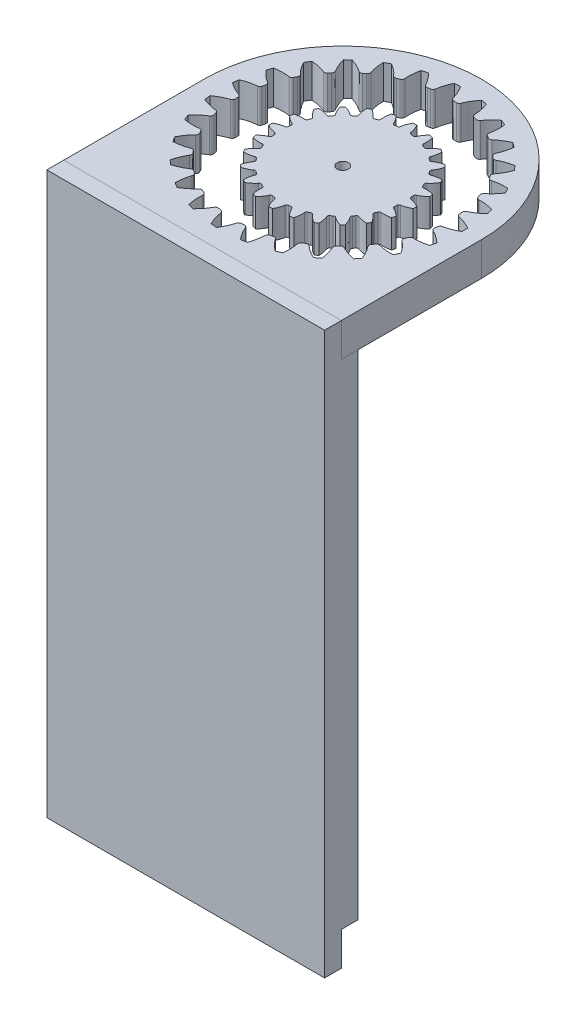
from build123d import *

# Parameters (mm, degrees)
SALIENTE_EXTRUIR1_OUTLINE_R         = 18.9375
SALIENTE_EXTRUIR1_DEPTH             = 6
SALIENTE_EXTRUIR1_2_OUTLINE_R       = 1
SALIENTE_EXTRUIR1_2_DEPTH           = 5
CORTAR_EXTRUIR2_DEPTH               = 36.68700744
REDONDEO1_R                         = 0.518506287
MATRIZC1_COUNT                      = 27
REDONDEO1_OF_MATRIZC1_R             = 0.518506287
SALIENTE_EXTRUIR2_REACH             = 37.687
SALIENTE_EXTRUIR2_DIRECTION_2_REACH = 37.687


with BuildPart() as part:
    # Saliente-Extruir1: read off the stored shape, not the designer's step
    # Saliente-Extruir1 outline → Saliente-Extruir1 (new body)
    with BuildSketch(Plane(origin=(0, 0, 0), x_dir=(1, 0, 0), z_dir=(0, 1, 0))):
        with BuildLine():
            ThreePointArc((24.75, 0), (0, 24.75), (-24.75, 0))
            Line((-24.75, 0), (-24.75, -25))
            Line((-24.75, -25), (24.75, -25))
            Line((24.75, -25), (24.75, 0))
        make_face()
        Circle(SALIENTE_EXTRUIR1_OUTLINE_R, mode=Mode.SUBTRACT)
    extrude(amount=SALIENTE_EXTRUIR1_DEPTH)

    # Croquis6 → Cortar-Extruir2 (cut, through all)
    with BuildSketch(Plane(origin=(0, 0, 0), x_dir=(1, 0, 0), z_dir=(0, 1, 0))):
        with BuildLine():
            Line((18.645829575, 1.539234613), (0, 0))
            Line((0, 0), (18.645829575, -1.539234613))
            add(Edge.make_bspline(
                [(18.645829575, -1.539234613), (18.923303573, -1.557894661), (19.482127586, -1.453363756), (20.528479497, -1.153187297), (21.271841826, -0.800092087), (21.743398201, -0.535849476)],
                knots=[0, 0, 0, 0, 0.227272729, 0.454545457, 0.900910646, 0.900910646, 0.900910646, 0.900910646], degree=3))
            ThreePointArc((21.743398201, -0.535849476), (21.75, 0), (21.743398201, 0.535849476))
            add(Edge.make_bspline(
                [(18.645829575, 1.539234613), (18.923303573, 1.557894661), (19.482127586, 1.453363756), (20.528479497, 1.153187297), (21.271841826, 0.800092087), (21.743398201, 0.535849476)],
                knots=[0, 0, 0, 0, 0.227272729, 0.454545457, 0.900910646, 0.900910646, 0.900910646, 0.900910646], degree=3))
        make_face()
    cortar_extruir2 = extrude(amount=CORTAR_EXTRUIR2_DEPTH, mode=Mode.SUBTRACT)

    # Redondeo1
    redondeo1_edges = [part.edges().sort_by_distance(p)[0] for p in [
        (18.87479761, 3, 1.539779672),
        (18.87479761, 3, -1.539779672),
    ]]
    fillet(redondeo1_edges, radius=REDONDEO1_R)

    # MatrizC1: Cortar-Extruir2 ×27 about axis
    matrizc1_axis = Axis((0, 6, 0), (0, -1, 0))
    for i in range(1, MATRIZC1_COUNT):
        add(cortar_extruir2.rotate(matrizc1_axis, i * 360 / MATRIZC1_COUNT), mode=Mode.SUBTRACT)

    # Redondeo1 of MatrizC1
    redondeo1_of_matrizc1_edges = [part.edges().sort_by_distance(p)[0] for p in [
        (18.010927368, 3, 5.851102598),
        (18.721122627, 3, 2.854553174),
        (16.176083369, 3, 9.846991068),
        (17.558187078, 3, 7.09499632),
        (13.469182529, 3, 13.312025701),
        (15.448685119, 3, 10.952946377),
        (10.036154572, 3, 16.059405582),
        (12.506340546, 3, 14.220420261),
        (6.062074925, 3, 17.941018752),
        (8.889775917, 3, 16.721267607),
        (1.76118725, 3, 18.855426957),
        (4.793961168, 3, 18.320667089),
        (-2.634646487, 3, 18.753334214),
        (0.439702731, 3, 18.932394665),
        (-6.888445749, 3, 17.64024437),
        (-3.938260194, 3, 18.523471945),
        (-10.770887117, 3, 15.576164385),
        (-8.103910492, 3, 17.115944058),
        (-14.072667174, 3, 12.672369347),
        (-11.832676879, 3, 14.785691196),
        (-16.6157861, 3, 9.085403597),
        (-14.923540592, 3, 11.658337894),
        (-18.263143697, 3, 5.008641388),
        (-17.209872369, 3, 7.902480579),
        (-18.92593049, 3, 0.661862025),
        (-18.568415471, 3, 3.720598491),
        (-18.568415471, 3, -3.720598491),
        (-18.92593049, 3, -0.661862025),
        (-17.209872369, 3, -7.902480579),
        (-18.263143697, 3, -5.008641388),
        (-14.923540592, 3, -11.658337894),
        (-16.6157861, 3, -9.085403597),
        (-11.832676879, 3, -14.785691196),
        (-14.072667174, 3, -12.672369347),
        (-8.103910492, 3, -17.115944058),
        (-10.770887117, 3, -15.576164385),
        (-3.938260194, 3, -18.523471945),
        (-6.888445749, 3, -17.64024437),
        (0.439702731, 3, -18.932394665),
        (-2.634646487, 3, -18.753334214),
        (4.793961168, 3, -18.320667089),
        (1.76118725, 3, -18.855426957),
        (8.889775917, 3, -16.721267607),
        (6.062074925, 3, -17.941018752),
        (12.506340546, 3, -14.220420261),
        (10.036154572, 3, -16.059405582),
        (15.448685119, 3, -10.952946377),
        (13.469182529, 3, -13.312025701),
        (17.558187078, 3, -7.09499632),
        (16.176083369, 3, -9.846991068),
        (18.721122627, 3, -2.854553174),
        (18.010927368, 3, -5.851102598),
    ]]
    fillet(redondeo1_of_matrizc1_edges, radius=REDONDEO1_OF_MATRIZC1_R)


with BuildPart() as body_2:
    # Saliente-Extruir1 2 outline → Saliente-Extruir1 2 (new body)
    with BuildSketch(Plane(origin=(0, 0, 0), x_dir=(1, 0, 0), z_dir=(0, 1, 0))):
        with BuildLine():
            ThreePointArc((10.245544348, 4.003601007), (10.162674858, 4.209517756), (10.075667306, 4.413720464))
            ThreePointArc((10.075667306, 4.413720464), (10.058954126, 4.643932984), (10.190868437, 4.833341931))
            add(Edge.make_bspline(
                [(10.190868437, 4.833341931), (10.274511974, 4.893314904), (10.478844857, 5.076658208), (10.881439467, 5.495896135), (11.153594645, 5.8906927), (11.309814146, 6.152538418)],
                knots=[0.087836958, 0.087836958, 0.087836958, 0.087836958, 0.227272729, 0.454545457, 0.858139361, 0.858139361, 0.858139361, 0.858139361], degree=3))
            ThreePointArc((11.309814146, 6.152538418), (11.150077074, 6.4375), (10.983161641, 6.718317153))
            add(Edge.make_bspline(
                [(10.983161641, 6.718317153), (10.678286846, 6.713949957), (10.200305403, 6.67565494), (9.635937403, 6.536616745), (9.374991003, 6.451330929), (9.281231116, 6.408879988)],
                knots=[0.050951553, 0.050951553, 0.050951553, 0.050951553, 0.454545457, 0.681818186, 0.821253956, 0.821253956, 0.821253956, 0.821253956], degree=3))
            ThreePointArc((9.281231116, 6.408879988), (9.051241001, 6.389343317), (8.8602277, 6.518923615))
            ThreePointArc((8.8602277, 6.518923615), (8.726886743, 6.696375719), (8.589992352, 6.871101177))
            ThreePointArc((8.589992352, 6.871101177), (8.514265275, 7.089143706), (8.592662073, 7.306240636))
            add(Edge.make_bspline(
                [(8.592662073, 7.306240636), (8.657933378, 7.38581862), (8.807851047, 7.615799894), (9.088220819, 8.124951788), (9.248921664, 8.576734929), (9.332047455, 8.870091053)],
                knots=[0.087836958, 0.087836958, 0.087836958, 0.087836958, 0.227272729, 0.454545457, 0.858139361, 0.858139361, 0.858139361, 0.858139361], degree=3))
            ThreePointArc((9.332047455, 8.870091053), (9.103999808, 9.103999808), (8.870091053, 9.332047455))
            add(Edge.make_bspline(
                [(8.870091053, 9.332047455), (8.576734929, 9.248921664), (8.124951788, 9.088220819), (7.615799894, 8.807851047), (7.38581862, 8.657933378), (7.306240636, 8.592662073)],
                knots=[0.050951553, 0.050951553, 0.050951553, 0.050951553, 0.454545457, 0.681818186, 0.821253956, 0.821253956, 0.821253956, 0.821253956], degree=3))
            ThreePointArc((7.306240636, 8.592662073), (7.089143706, 8.514265275), (6.871101177, 8.589992352))
            ThreePointArc((6.871101177, 8.589992352), (6.696375719, 8.726886743), (6.518923615, 8.8602277))
            ThreePointArc((6.518923615, 8.8602277), (6.389343317, 9.051241001), (6.408879988, 9.281231116))
            add(Edge.make_bspline(
                [(6.408879988, 9.281231116), (6.451330929, 9.374991003), (6.536616745, 9.635937403), (6.67565494, 10.200305403), (6.713949957, 10.678286846), (6.718317153, 10.983161641)],
                knots=[0.087836958, 0.087836958, 0.087836958, 0.087836958, 0.227272729, 0.454545457, 0.858139361, 0.858139361, 0.858139361, 0.858139361], degree=3))
            ThreePointArc((6.718317153, 10.983161641), (6.4375, 11.150077074), (6.152538418, 11.309814146))
            add(Edge.make_bspline(
                [(6.152538418, 11.309814146), (5.8906927, 11.153594645), (5.495896135, 10.881439467), (5.076658208, 10.478844857), (4.893314904, 10.274511974), (4.833341931, 10.190868437)],
                knots=[0.050951553, 0.050951553, 0.050951553, 0.050951553, 0.454545457, 0.681818186, 0.821253956, 0.821253956, 0.821253956, 0.821253956], degree=3))
            ThreePointArc((4.833341931, 10.190868437), (4.643932984, 10.058954126), (4.413720464, 10.075667306))
            ThreePointArc((4.413720464, 10.075667306), (4.209517756, 10.162674858), (4.003601007, 10.245544348))
            ThreePointArc((4.003601007, 10.245544348), (3.82899817, 10.396511178), (3.788343323, 10.623721033))
            add(Edge.make_bspline(
                [(3.788343323, 10.623721033), (3.805080939, 10.725273242), (3.819922813, 10.999401702), (3.80815421, 11.580525062), (3.721433655, 12.052131162), (3.646744639, 12.347747914)],
                knots=[0.087836958, 0.087836958, 0.087836958, 0.087836958, 0.227272729, 0.454545457, 0.858139361, 0.858139361, 0.858139361, 0.858139361], degree=3))
            ThreePointArc((3.646744639, 12.347747914), (3.332295205, 12.436295013), (3.015700458, 12.516835692))
            add(Edge.make_bspline(
                [(3.015700458, 12.516835692), (2.803209498, 12.298168583), (2.492304244, 11.933105998), (2.191550655, 11.435722707), (2.067339864, 11.190899559), (2.03105896, 11.094583959)],
                knots=[0.050951553, 0.050951553, 0.050951553, 0.050951553, 0.454545457, 0.681818186, 0.821253956, 0.821253956, 0.821253956, 0.821253956], degree=3))
            ThreePointArc((2.03105896, 11.094583959), (1.882245903, 10.918141876), (1.655551995, 10.874702184))
            ThreePointArc((1.655551995, 10.874702184), (1.435788114, 10.905893475), (1.215439606, 10.932644079))
            ThreePointArc((1.215439606, 10.932644079), (1.007713125, 11.033276301), (0.909637322, 11.242221919))
            add(Edge.make_bspline(
                [(0.909637322, 11.242221919), (0.899520971, 11.344645833), (0.842907454, 11.613274952), (0.681134064, 12.171551076), (0.475307799, 12.604642656), (0.326652505, 12.870855571)],
                knots=[0.087836958, 0.087836958, 0.087836958, 0.087836958, 0.227272729, 0.454545457, 0.858139361, 0.858139361, 0.858139361, 0.858139361], degree=3))
            ThreePointArc((0.326652505, 12.870855571), (0, 12.875), (-0.326652505, 12.870855571))
            add(Edge.make_bspline(
                [(-0.326652505, 12.870855571), (-0.475307799, 12.604642656), (-0.681134064, 12.171551076), (-0.842907454, 11.613274952), (-0.899520971, 11.344645833), (-0.909637322, 11.242221919)],
                knots=[0.050951553, 0.050951553, 0.050951553, 0.050951553, 0.454545457, 0.681818186, 0.821253956, 0.821253956, 0.821253956, 0.821253956], degree=3))
            ThreePointArc((-0.909637322, 11.242221919), (-1.007713125, 11.033276301), (-1.215439606, 10.932644079))
            ThreePointArc((-1.215439606, 10.932644079), (-1.435788114, 10.905893475), (-1.655551995, 10.874702184))
            ThreePointArc((-1.655551995, 10.874702184), (-1.882245903, 10.918141876), (-2.03105896, 11.094583959))
            add(Edge.make_bspline(
                [(-2.03105896, 11.094583959), (-2.067339864, 11.190899559), (-2.191550655, 11.435722707), (-2.492304244, 11.933105998), (-2.803209498, 12.298168583), (-3.015700458, 12.516835692)],
                knots=[0.087836958, 0.087836958, 0.087836958, 0.087836958, 0.227272729, 0.454545457, 0.858139361, 0.858139361, 0.858139361, 0.858139361], degree=3))
            ThreePointArc((-3.015700458, 12.516835692), (-3.332295205, 12.436295013), (-3.646744639, 12.347747914))
            add(Edge.make_bspline(
                [(-3.646744639, 12.347747914), (-3.721433655, 12.052131162), (-3.80815421, 11.580525062), (-3.819922813, 10.999401702), (-3.805080939, 10.725273242), (-3.788343323, 10.623721033)],
                knots=[0.050951553, 0.050951553, 0.050951553, 0.050951553, 0.454545457, 0.681818186, 0.821253956, 0.821253956, 0.821253956, 0.821253956], degree=3))
            ThreePointArc((-3.788343323, 10.623721033), (-3.82899817, 10.396511178), (-4.003601007, 10.245544348))
            ThreePointArc((-4.003601007, 10.245544348), (-4.209517756, 10.162674858), (-4.413720464, 10.075667306))
            ThreePointArc((-4.413720464, 10.075667306), (-4.643932984, 10.058954126), (-4.833341931, 10.190868437))
            add(Edge.make_bspline(
                [(-4.833341931, 10.190868437), (-4.893314904, 10.274511974), (-5.076658208, 10.478844857), (-5.495896135, 10.881439467), (-5.8906927, 11.153594645), (-6.152538418, 11.309814146)],
                knots=[0.087836958, 0.087836958, 0.087836958, 0.087836958, 0.227272729, 0.454545457, 0.858139361, 0.858139361, 0.858139361, 0.858139361], degree=3))
            ThreePointArc((-6.152538418, 11.309814146), (-6.4375, 11.150077074), (-6.718317153, 10.983161641))
            add(Edge.make_bspline(
                [(-6.718317153, 10.983161641), (-6.713949957, 10.678286846), (-6.67565494, 10.200305403), (-6.536616745, 9.635937403), (-6.451330929, 9.374991003), (-6.408879988, 9.281231116)],
                knots=[0.050951553, 0.050951553, 0.050951553, 0.050951553, 0.454545457, 0.681818186, 0.821253956, 0.821253956, 0.821253956, 0.821253956], degree=3))
            ThreePointArc((-6.408879988, 9.281231116), (-6.389343317, 9.051241001), (-6.518923615, 8.8602277))
            ThreePointArc((-6.518923615, 8.8602277), (-6.696375719, 8.726886743), (-6.871101177, 8.589992352))
            ThreePointArc((-6.871101177, 8.589992352), (-7.089143706, 8.514265275), (-7.306240636, 8.592662073))
            add(Edge.make_bspline(
                [(-7.306240636, 8.592662073), (-7.38581862, 8.657933378), (-7.615799894, 8.807851047), (-8.124951788, 9.088220819), (-8.576734929, 9.248921664), (-8.870091053, 9.332047455)],
                knots=[0.087836958, 0.087836958, 0.087836958, 0.087836958, 0.227272729, 0.454545457, 0.858139361, 0.858139361, 0.858139361, 0.858139361], degree=3))
            ThreePointArc((-8.870091053, 9.332047455), (-9.103999808, 9.103999808), (-9.332047455, 8.870091053))
            add(Edge.make_bspline(
                [(-9.332047455, 8.870091053), (-9.248921664, 8.576734929), (-9.088220819, 8.124951788), (-8.807851047, 7.615799894), (-8.657933378, 7.38581862), (-8.592662073, 7.306240636)],
                knots=[0.050951553, 0.050951553, 0.050951553, 0.050951553, 0.454545457, 0.681818186, 0.821253956, 0.821253956, 0.821253956, 0.821253956], degree=3))
            ThreePointArc((-8.592662073, 7.306240636), (-8.514265275, 7.089143706), (-8.589992352, 6.871101177))
            ThreePointArc((-8.589992352, 6.871101177), (-8.726886743, 6.696375719), (-8.8602277, 6.518923615))
            ThreePointArc((-8.8602277, 6.518923615), (-9.051241001, 6.389343317), (-9.281231116, 6.408879988))
            add(Edge.make_bspline(
                [(-9.281231116, 6.408879988), (-9.374991003, 6.451330929), (-9.635937403, 6.536616745), (-10.200305403, 6.67565494), (-10.678286846, 6.713949957), (-10.983161641, 6.718317153)],
                knots=[0.087836958, 0.087836958, 0.087836958, 0.087836958, 0.227272729, 0.454545457, 0.858139361, 0.858139361, 0.858139361, 0.858139361], degree=3))
            ThreePointArc((-10.983161641, 6.718317153), (-11.150077074, 6.4375), (-11.309814146, 6.152538418))
            add(Edge.make_bspline(
                [(-11.309814146, 6.152538418), (-11.153594645, 5.8906927), (-10.881439467, 5.495896135), (-10.478844857, 5.076658208), (-10.274511974, 4.893314904), (-10.190868437, 4.833341931)],
                knots=[0.050951553, 0.050951553, 0.050951553, 0.050951553, 0.454545457, 0.681818186, 0.821253956, 0.821253956, 0.821253956, 0.821253956], degree=3))
            ThreePointArc((-10.190868437, 4.833341931), (-10.058954126, 4.643932984), (-10.075667306, 4.413720464))
            ThreePointArc((-10.075667306, 4.413720464), (-10.162674858, 4.209517756), (-10.245544348, 4.003601007))
            ThreePointArc((-10.245544348, 4.003601007), (-10.396511178, 3.82899817), (-10.623721033, 3.788343323))
            add(Edge.make_bspline(
                [(-10.623721033, 3.788343323), (-10.725273242, 3.805080939), (-10.999401702, 3.819922813), (-11.580525062, 3.80815421), (-12.052131162, 3.721433655), (-12.347747914, 3.646744639)],
                knots=[0.087836958, 0.087836958, 0.087836958, 0.087836958, 0.227272729, 0.454545457, 0.858139361, 0.858139361, 0.858139361, 0.858139361], degree=3))
            ThreePointArc((-12.347747914, 3.646744639), (-12.436295013, 3.332295205), (-12.516835692, 3.015700458))
            add(Edge.make_bspline(
                [(-12.516835692, 3.015700458), (-12.298168583, 2.803209498), (-11.933105998, 2.492304244), (-11.435722707, 2.191550655), (-11.190899559, 2.067339864), (-11.094583959, 2.03105896)],
                knots=[0.050951553, 0.050951553, 0.050951553, 0.050951553, 0.454545457, 0.681818186, 0.821253956, 0.821253956, 0.821253956, 0.821253956], degree=3))
            ThreePointArc((-11.094583959, 2.03105896), (-10.918141876, 1.882245903), (-10.874702184, 1.655551995))
            ThreePointArc((-10.874702184, 1.655551995), (-10.905893475, 1.435788114), (-10.932644079, 1.215439606))
            ThreePointArc((-10.932644079, 1.215439606), (-11.033276301, 1.007713125), (-11.242221919, 0.909637322))
            add(Edge.make_bspline(
                [(-11.242221919, 0.909637322), (-11.344645833, 0.899520971), (-11.613274952, 0.842907454), (-12.171551076, 0.681134064), (-12.604642656, 0.475307799), (-12.870855571, 0.326652505)],
                knots=[0.087836958, 0.087836958, 0.087836958, 0.087836958, 0.227272729, 0.454545457, 0.858139361, 0.858139361, 0.858139361, 0.858139361], degree=3))
            ThreePointArc((-12.870855571, 0.326652505), (-12.875, 0), (-12.870855571, -0.326652505))
            add(Edge.make_bspline(
                [(-12.870855571, -0.326652505), (-12.604642656, -0.475307799), (-12.171551076, -0.681134064), (-11.613274952, -0.842907454), (-11.344645833, -0.899520971), (-11.242221919, -0.909637322)],
                knots=[0.050951553, 0.050951553, 0.050951553, 0.050951553, 0.454545457, 0.681818186, 0.821253956, 0.821253956, 0.821253956, 0.821253956], degree=3))
            ThreePointArc((-11.242221919, -0.909637322), (-11.033276301, -1.007713125), (-10.932644079, -1.215439606))
            ThreePointArc((-10.932644079, -1.215439606), (-10.905893475, -1.435788114), (-10.874702184, -1.655551995))
            ThreePointArc((-10.874702184, -1.655551995), (-10.918141876, -1.882245903), (-11.094583959, -2.03105896))
            add(Edge.make_bspline(
                [(-11.094583959, -2.03105896), (-11.190899559, -2.067339864), (-11.435722707, -2.191550655), (-11.933105998, -2.492304244), (-12.298168583, -2.803209498), (-12.516835692, -3.015700458)],
                knots=[0.087836958, 0.087836958, 0.087836958, 0.087836958, 0.227272729, 0.454545457, 0.858139361, 0.858139361, 0.858139361, 0.858139361], degree=3))
            ThreePointArc((-12.516835692, -3.015700458), (-12.436295013, -3.332295205), (-12.347747914, -3.646744639))
            add(Edge.make_bspline(
                [(-12.347747914, -3.646744639), (-12.052131162, -3.721433655), (-11.580525062, -3.80815421), (-10.999401702, -3.819922813), (-10.725273242, -3.805080939), (-10.623721033, -3.788343323)],
                knots=[0.050951553, 0.050951553, 0.050951553, 0.050951553, 0.454545457, 0.681818186, 0.821253956, 0.821253956, 0.821253956, 0.821253956], degree=3))
            ThreePointArc((-10.623721033, -3.788343323), (-10.396511178, -3.82899817), (-10.245544348, -4.003601007))
            ThreePointArc((-10.245544348, -4.003601007), (-10.162674858, -4.209517756), (-10.075667306, -4.413720464))
            ThreePointArc((-10.075667306, -4.413720464), (-10.058954126, -4.643932984), (-10.190868437, -4.833341931))
            add(Edge.make_bspline(
                [(-10.190868437, -4.833341931), (-10.274511974, -4.893314904), (-10.478844857, -5.076658208), (-10.881439467, -5.495896135), (-11.153594645, -5.8906927), (-11.309814146, -6.152538418)],
                knots=[0.087836958, 0.087836958, 0.087836958, 0.087836958, 0.227272729, 0.454545457, 0.858139361, 0.858139361, 0.858139361, 0.858139361], degree=3))
            ThreePointArc((-11.309814146, -6.152538418), (-11.150077074, -6.4375), (-10.983161641, -6.718317153))
            add(Edge.make_bspline(
                [(-10.983161641, -6.718317153), (-10.678286846, -6.713949957), (-10.200305403, -6.67565494), (-9.635937403, -6.536616745), (-9.374991003, -6.451330929), (-9.281231116, -6.408879988)],
                knots=[0.050951553, 0.050951553, 0.050951553, 0.050951553, 0.454545457, 0.681818186, 0.821253956, 0.821253956, 0.821253956, 0.821253956], degree=3))
            ThreePointArc((-9.281231116, -6.408879988), (-9.051241001, -6.389343317), (-8.8602277, -6.518923615))
            ThreePointArc((-8.8602277, -6.518923615), (-8.726886743, -6.696375719), (-8.589992352, -6.871101177))
            ThreePointArc((-8.589992352, -6.871101177), (-8.514265275, -7.089143706), (-8.592662073, -7.306240636))
            add(Edge.make_bspline(
                [(-8.592662073, -7.306240636), (-8.657933378, -7.38581862), (-8.807851047, -7.615799894), (-9.088220819, -8.124951788), (-9.248921664, -8.576734929), (-9.332047455, -8.870091053)],
                knots=[0.087836958, 0.087836958, 0.087836958, 0.087836958, 0.227272729, 0.454545457, 0.858139361, 0.858139361, 0.858139361, 0.858139361], degree=3))
            ThreePointArc((-9.332047455, -8.870091053), (-9.103999808, -9.103999808), (-8.870091053, -9.332047455))
            add(Edge.make_bspline(
                [(-8.870091053, -9.332047455), (-8.576734929, -9.248921664), (-8.124951788, -9.088220819), (-7.615799894, -8.807851047), (-7.38581862, -8.657933378), (-7.306240636, -8.592662073)],
                knots=[0.050951553, 0.050951553, 0.050951553, 0.050951553, 0.454545457, 0.681818186, 0.821253956, 0.821253956, 0.821253956, 0.821253956], degree=3))
            ThreePointArc((-7.306240636, -8.592662073), (-7.089143706, -8.514265275), (-6.871101177, -8.589992352))
            ThreePointArc((-6.871101177, -8.589992352), (-6.696375719, -8.726886743), (-6.518923615, -8.8602277))
            ThreePointArc((-6.518923615, -8.8602277), (-6.389343317, -9.051241001), (-6.408879988, -9.281231116))
            add(Edge.make_bspline(
                [(-6.408879988, -9.281231116), (-6.451330929, -9.374991003), (-6.536616745, -9.635937403), (-6.67565494, -10.200305403), (-6.713949957, -10.678286846), (-6.718317153, -10.983161641)],
                knots=[0.087836958, 0.087836958, 0.087836958, 0.087836958, 0.227272729, 0.454545457, 0.858139361, 0.858139361, 0.858139361, 0.858139361], degree=3))
            ThreePointArc((-6.718317153, -10.983161641), (-6.4375, -11.150077074), (-6.152538418, -11.309814146))
            add(Edge.make_bspline(
                [(-6.152538418, -11.309814146), (-5.8906927, -11.153594645), (-5.495896135, -10.881439467), (-5.076658208, -10.478844857), (-4.893314904, -10.274511974), (-4.833341931, -10.190868437)],
                knots=[0.050951553, 0.050951553, 0.050951553, 0.050951553, 0.454545457, 0.681818186, 0.821253956, 0.821253956, 0.821253956, 0.821253956], degree=3))
            ThreePointArc((-4.833341931, -10.190868437), (-4.643932984, -10.058954126), (-4.413720464, -10.075667306))
            ThreePointArc((-4.413720464, -10.075667306), (-4.209517756, -10.162674858), (-4.003601007, -10.245544348))
            ThreePointArc((-4.003601007, -10.245544348), (-3.82899817, -10.396511178), (-3.788343323, -10.623721033))
            add(Edge.make_bspline(
                [(-3.788343323, -10.623721033), (-3.805080939, -10.725273242), (-3.819922813, -10.999401702), (-3.80815421, -11.580525062), (-3.721433655, -12.052131162), (-3.646744639, -12.347747914)],
                knots=[0.087836958, 0.087836958, 0.087836958, 0.087836958, 0.227272729, 0.454545457, 0.858139361, 0.858139361, 0.858139361, 0.858139361], degree=3))
            ThreePointArc((-3.646744639, -12.347747914), (-3.332295205, -12.436295013), (-3.015700458, -12.516835692))
            add(Edge.make_bspline(
                [(-3.015700458, -12.516835692), (-2.803209498, -12.298168583), (-2.492304244, -11.933105998), (-2.191550655, -11.435722707), (-2.067339864, -11.190899559), (-2.03105896, -11.094583959)],
                knots=[0.050951553, 0.050951553, 0.050951553, 0.050951553, 0.454545457, 0.681818186, 0.821253956, 0.821253956, 0.821253956, 0.821253956], degree=3))
            ThreePointArc((-2.03105896, -11.094583959), (-1.882245903, -10.918141876), (-1.655551995, -10.874702184))
            ThreePointArc((-1.655551995, -10.874702184), (-1.435788114, -10.905893475), (-1.215439606, -10.932644079))
            ThreePointArc((-1.215439606, -10.932644079), (-1.007713125, -11.033276301), (-0.909637322, -11.242221919))
            add(Edge.make_bspline(
                [(-0.909637322, -11.242221919), (-0.899520971, -11.344645833), (-0.842907454, -11.613274952), (-0.681134064, -12.171551076), (-0.475307799, -12.604642656), (-0.326652505, -12.870855571)],
                knots=[0.087836958, 0.087836958, 0.087836958, 0.087836958, 0.227272729, 0.454545457, 0.858139361, 0.858139361, 0.858139361, 0.858139361], degree=3))
            ThreePointArc((-0.326652505, -12.870855571), (0, -12.875), (0.326652505, -12.870855571))
            add(Edge.make_bspline(
                [(0.326652505, -12.870855571), (0.475307799, -12.604642656), (0.681134064, -12.171551076), (0.842907454, -11.613274952), (0.899520971, -11.344645833), (0.909637322, -11.242221919)],
                knots=[0.050951553, 0.050951553, 0.050951553, 0.050951553, 0.454545457, 0.681818186, 0.821253956, 0.821253956, 0.821253956, 0.821253956], degree=3))
            ThreePointArc((0.909637322, -11.242221919), (1.007713125, -11.033276301), (1.215439606, -10.932644079))
            ThreePointArc((1.215439606, -10.932644079), (1.435788114, -10.905893475), (1.655551995, -10.874702184))
            ThreePointArc((1.655551995, -10.874702184), (1.882245903, -10.918141876), (2.03105896, -11.094583959))
            add(Edge.make_bspline(
                [(2.03105896, -11.094583959), (2.067339864, -11.190899559), (2.191550655, -11.435722707), (2.492304244, -11.933105998), (2.803209498, -12.298168583), (3.015700458, -12.516835692)],
                knots=[0.087836958, 0.087836958, 0.087836958, 0.087836958, 0.227272729, 0.454545457, 0.858139361, 0.858139361, 0.858139361, 0.858139361], degree=3))
            ThreePointArc((3.015700458, -12.516835692), (3.332295205, -12.436295013), (3.646744639, -12.347747914))
            add(Edge.make_bspline(
                [(3.646744639, -12.347747914), (3.721433655, -12.052131162), (3.80815421, -11.580525062), (3.819922813, -10.999401702), (3.805080939, -10.725273242), (3.788343323, -10.623721033)],
                knots=[0.050951553, 0.050951553, 0.050951553, 0.050951553, 0.454545457, 0.681818186, 0.821253956, 0.821253956, 0.821253956, 0.821253956], degree=3))
            ThreePointArc((3.788343323, -10.623721033), (3.82899817, -10.396511178), (4.003601007, -10.245544348))
            ThreePointArc((4.003601007, -10.245544348), (4.209517756, -10.162674858), (4.413720464, -10.075667306))
            ThreePointArc((4.413720464, -10.075667306), (4.643932984, -10.058954126), (4.833341931, -10.190868437))
            add(Edge.make_bspline(
                [(4.833341931, -10.190868437), (4.893314904, -10.274511974), (5.076658208, -10.478844857), (5.495896135, -10.881439467), (5.8906927, -11.153594645), (6.152538418, -11.309814146)],
                knots=[0.087836958, 0.087836958, 0.087836958, 0.087836958, 0.227272729, 0.454545457, 0.858139361, 0.858139361, 0.858139361, 0.858139361], degree=3))
            ThreePointArc((6.152538418, -11.309814146), (6.4375, -11.150077074), (6.718317153, -10.983161641))
            add(Edge.make_bspline(
                [(6.718317153, -10.983161641), (6.713949957, -10.678286846), (6.67565494, -10.200305403), (6.536616745, -9.635937403), (6.451330929, -9.374991003), (6.408879988, -9.281231116)],
                knots=[0.050951553, 0.050951553, 0.050951553, 0.050951553, 0.454545457, 0.681818186, 0.821253956, 0.821253956, 0.821253956, 0.821253956], degree=3))
            ThreePointArc((6.408879988, -9.281231116), (6.389343317, -9.051241001), (6.518923615, -8.8602277))
            ThreePointArc((6.518923615, -8.8602277), (6.696375719, -8.726886743), (6.871101177, -8.589992352))
            ThreePointArc((6.871101177, -8.589992352), (7.089143706, -8.514265275), (7.306240636, -8.592662073))
            add(Edge.make_bspline(
                [(7.306240636, -8.592662073), (7.38581862, -8.657933378), (7.615799894, -8.807851047), (8.124951788, -9.088220819), (8.576734929, -9.248921664), (8.870091053, -9.332047455)],
                knots=[0.087836958, 0.087836958, 0.087836958, 0.087836958, 0.227272729, 0.454545457, 0.858139361, 0.858139361, 0.858139361, 0.858139361], degree=3))
            ThreePointArc((8.870091053, -9.332047455), (9.103999808, -9.103999808), (9.332047455, -8.870091053))
            add(Edge.make_bspline(
                [(9.332047455, -8.870091053), (9.248921664, -8.576734929), (9.088220819, -8.124951788), (8.807851047, -7.615799894), (8.657933378, -7.38581862), (8.592662073, -7.306240636)],
                knots=[0.050951553, 0.050951553, 0.050951553, 0.050951553, 0.454545457, 0.681818186, 0.821253956, 0.821253956, 0.821253956, 0.821253956], degree=3))
            ThreePointArc((8.592662073, -7.306240636), (8.514265275, -7.089143706), (8.589992352, -6.871101177))
            ThreePointArc((8.589992352, -6.871101177), (8.726886743, -6.696375719), (8.8602277, -6.518923615))
            ThreePointArc((8.8602277, -6.518923615), (9.051241001, -6.389343317), (9.281231116, -6.408879988))
            add(Edge.make_bspline(
                [(9.281231116, -6.408879988), (9.374991003, -6.451330929), (9.635937403, -6.536616745), (10.200305403, -6.67565494), (10.678286846, -6.713949957), (10.983161641, -6.718317153)],
                knots=[0.087836958, 0.087836958, 0.087836958, 0.087836958, 0.227272729, 0.454545457, 0.858139361, 0.858139361, 0.858139361, 0.858139361], degree=3))
            ThreePointArc((10.983161641, -6.718317153), (11.150077074, -6.4375), (11.309814146, -6.152538418))
            add(Edge.make_bspline(
                [(11.309814146, -6.152538418), (11.153594645, -5.8906927), (10.881439467, -5.495896135), (10.478844857, -5.076658208), (10.274511974, -4.893314904), (10.190868437, -4.833341931)],
                knots=[0.050951553, 0.050951553, 0.050951553, 0.050951553, 0.454545457, 0.681818186, 0.821253956, 0.821253956, 0.821253956, 0.821253956], degree=3))
            ThreePointArc((10.190868437, -4.833341931), (10.058954126, -4.643932984), (10.075667306, -4.413720464))
            ThreePointArc((10.075667306, -4.413720464), (10.162674858, -4.209517756), (10.245544348, -4.003601007))
            ThreePointArc((10.245544348, -4.003601007), (10.396511178, -3.82899817), (10.623721033, -3.788343323))
            add(Edge.make_bspline(
                [(10.623721033, -3.788343323), (10.725273242, -3.805080939), (10.999401702, -3.819922813), (11.580525062, -3.80815421), (12.052131162, -3.721433655), (12.347747914, -3.646744639)],
                knots=[0.087836958, 0.087836958, 0.087836958, 0.087836958, 0.227272729, 0.454545457, 0.858139361, 0.858139361, 0.858139361, 0.858139361], degree=3))
            ThreePointArc((12.347747914, -3.646744639), (12.436295013, -3.332295205), (12.516835692, -3.015700458))
            add(Edge.make_bspline(
                [(12.516835692, -3.015700458), (12.298168583, -2.803209498), (11.933105998, -2.492304244), (11.435722707, -2.191550655), (11.190899559, -2.067339864), (11.094583959, -2.03105896)],
                knots=[0.050951553, 0.050951553, 0.050951553, 0.050951553, 0.454545457, 0.681818186, 0.821253956, 0.821253956, 0.821253956, 0.821253956], degree=3))
            ThreePointArc((11.094583959, -2.03105896), (10.918141876, -1.882245903), (10.874702184, -1.655551995))
            ThreePointArc((10.874702184, -1.655551995), (10.905893475, -1.435788114), (10.932644079, -1.215439606))
            ThreePointArc((10.932644079, -1.215439606), (11.033276301, -1.007713125), (11.242221919, -0.909637322))
            add(Edge.make_bspline(
                [(11.242221919, -0.909637322), (11.344645833, -0.899520971), (11.613274952, -0.842907454), (12.171551076, -0.681134064), (12.604642656, -0.475307799), (12.870855571, -0.326652505)],
                knots=[0.087836958, 0.087836958, 0.087836958, 0.087836958, 0.227272729, 0.454545457, 0.858139361, 0.858139361, 0.858139361, 0.858139361], degree=3))
            ThreePointArc((12.870855571, -0.326652505), (12.875, 0), (12.870855571, 0.326652505))
            add(Edge.make_bspline(
                [(12.870855571, 0.326652505), (12.604642656, 0.475307799), (12.171551076, 0.681134064), (11.613274952, 0.842907454), (11.344645833, 0.899520971), (11.242221919, 0.909637322)],
                knots=[0.050951553, 0.050951553, 0.050951553, 0.050951553, 0.454545457, 0.681818186, 0.821253956, 0.821253956, 0.821253956, 0.821253956], degree=3))
            ThreePointArc((11.242221919, 0.909637322), (11.033276301, 1.007713125), (10.932644079, 1.215439606))
            ThreePointArc((10.932644079, 1.215439606), (10.905893475, 1.435788114), (10.874702184, 1.655551995))
            ThreePointArc((10.874702184, 1.655551995), (10.918141876, 1.882245903), (11.094583959, 2.03105896))
            add(Edge.make_bspline(
                [(11.094583959, 2.03105896), (11.190899559, 2.067339864), (11.435722707, 2.191550655), (11.933105998, 2.492304244), (12.298168583, 2.803209498), (12.516835692, 3.015700458)],
                knots=[0.087836958, 0.087836958, 0.087836958, 0.087836958, 0.227272729, 0.454545457, 0.858139361, 0.858139361, 0.858139361, 0.858139361], degree=3))
            ThreePointArc((12.516835692, 3.015700458), (12.436295013, 3.332295205), (12.347747914, 3.646744639))
            add(Edge.make_bspline(
                [(12.347747914, 3.646744639), (12.052131162, 3.721433655), (11.580525062, 3.80815421), (10.999401702, 3.819922813), (10.725273242, 3.805080939), (10.623721033, 3.788343323)],
                knots=[0.050951553, 0.050951553, 0.050951553, 0.050951553, 0.454545457, 0.681818186, 0.821253956, 0.821253956, 0.821253956, 0.821253956], degree=3))
            ThreePointArc((10.623721033, 3.788343323), (10.396511178, 3.82899817), (10.245544348, 4.003601007))
        make_face()
        Circle(SALIENTE_EXTRUIR1_2_OUTLINE_R, mode=Mode.SUBTRACT)
    extrude(amount=SALIENTE_EXTRUIR1_2_DEPTH)


with BuildPart() as body_3:

    # Saliente-Extruir2: up to this face of the body (flat: up to its plane)
    saliente_extruir2_end = Plane(part.part.faces().sort_by_distance((24.75, 3, 12.5))[0])
    # Croquis7 → Saliente-Extruir2 (new, up to the picked face)
    with BuildSketch(Plane(origin=(0, 0, 0), x_dir=(0, 0, -1), z_dir=(1, 0, 0)), mode=Mode.PRIVATE) as saliente_extruir2_sk1:
        Polygon((-28, 6), (-25, 6), (-25, 0), (-22, 0), (-22, -88), (-25, -88), (-25, -94), (-28, -94), align=None)
    saliente_extruir2_tool1 = split(extrude(saliente_extruir2_sk1.sketch, amount=SALIENTE_EXTRUIR2_REACH, mode=Mode.PRIVATE), bisect_by=saliente_extruir2_end, keep=Keep.BOTH, mode=Mode.PRIVATE)
    add(saliente_extruir2_tool1.solids().sort_by(Axis((0, -44, 25.095745), (1, 0, 0)))[0])


    # Saliente-Extruir2 direction 2: up to this face of the body (flat: up to its plane)
    saliente_extruir2_direction_2_end = Plane(part.part.faces().sort_by_distance((-24.75, 3, 12.5))[0])
    # Croquis7 → Saliente-Extruir2 direction 2 (add, up to the picked face)
    with BuildSketch(Plane(origin=(0, 0, 0), x_dir=(0, 0, -1), z_dir=(1, 0, 0)), mode=Mode.PRIVATE) as saliente_extruir2_direction_2_sk1:
        Polygon((-28, 6), (-25, 6), (-25, 0), (-22, 0), (-22, -88), (-25, -88), (-25, -94), (-28, -94), align=None)
    saliente_extruir2_direction_2_tool1 = split(extrude(saliente_extruir2_direction_2_sk1.sketch, amount=-SALIENTE_EXTRUIR2_DIRECTION_2_REACH, mode=Mode.PRIVATE), bisect_by=saliente_extruir2_direction_2_end, keep=Keep.BOTH, mode=Mode.PRIVATE)
    add(saliente_extruir2_direction_2_tool1.solids().sort_by(Axis((0, -44, 25.095745), (-1, 0, 0)))[0])


solid = Compound([part.part, body_2.part, body_3.part])
